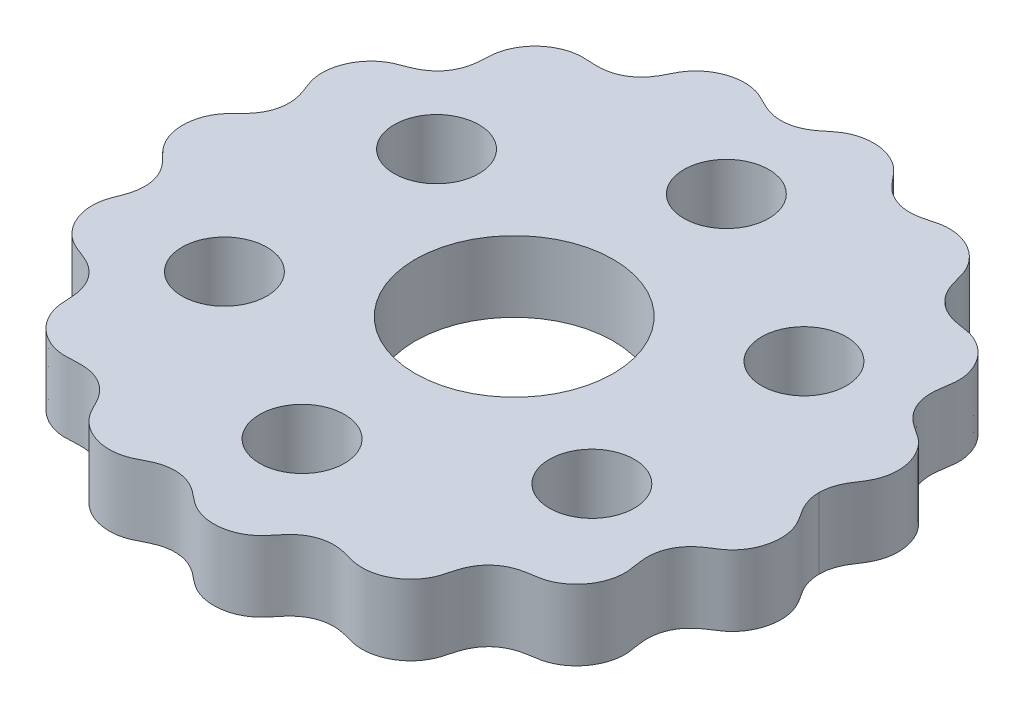
from build123d import *

# Parameters (mm, degrees)
BOSS_EXTRUDE1_DEPTH = 10
SKETCH2_R           = 14
SKETCH2_R_2         = 6
CUT_EXTRUDE1_DEPTH  = 10


with BuildPart() as part:
    # Sketch1 → Boss-Extrude1 (new body)
    with BuildSketch(Plane(origin=(0, 0, 0), x_dir=(1, 0, 0), z_dir=(0, 1, 0))):
        with BuildLine():
            add(Edge.make_bspline(
                [(43.125, 0), (43.125, -0.04253376), (43.125842023, -0.105329029), (43.128648775, -0.219501248), (43.135019123, -0.352292602), (43.141932928, -0.454759474), (43.15293713, -0.582006478), (43.169926456, -0.737698323), (43.195057818, -0.920018582), (43.230988459, -1.126003403), (43.274023628, -1.331077263), (43.33656904, -1.585225597), (43.454877118, -1.987246867), (43.659957218, -2.526165865), (44.003257795, -3.208529191), (44.486703726, -3.963009603), (45.011710901, -4.724365647), (45.464881913, -5.566998571), (45.829789729, -6.583473472), (46.037635432, -7.769953603), (46.018876274, -9.108172689), (45.699173049, -10.541997716), (45.13241202, -11.790586356), (44.391420513, -12.821058061), (43.553658534, -13.62486626), (42.686773685, -14.218656762), (41.847173706, -14.723738241), (41.113010158, -15.27010197), (40.356508237, -15.984911286), (39.64401467, -16.920938383), (39.065487742, -18.176194843), (38.821808048, -19.614860862), (38.883740817, -20.808738979), (39.036511831, -21.728716893), (39.149999061, -22.395010733), (39.218485568, -22.931744545), (39.256494717, -23.607184213), (39.20773201, -24.529298073), (38.956646376, -25.675266369), (38.383638085, -26.966438066), (37.491280365, -28.188034586), (36.456233226, -29.112194815), (35.371495342, -29.751280862), (34.300362256, -30.144907835), (33.296839208, -30.340567925), (32.34235617, -30.45668892), (31.455433855, -30.643043045), (30.650677042, -30.910490339), (29.936591375, -31.250491088), (29.11286761, -31.781933535), (28.252053762, -32.581040774), (27.616924672, -33.501658002), (27.196078853, -34.46335063), (26.957088965, -35.223334671), (26.81673532, -35.752261367), (26.683233633, -36.282678413), (26.531216493, -36.808512671), (26.297110502, -37.451705898), (25.883256178, -38.290560319), (25.188270048, -39.256343387), (24.124812446, -40.230448913), (22.778201742, -41.008012636), (21.402888244, -41.44171185), (20.21887944, -41.561053404), (19.285736569, -41.499490672), (18.47628618, -41.357950231), (17.68481965, -41.139805876), (16.656909007, -40.841140025), (15.342614716, -40.657065554), (13.891256715, -40.773177402), (12.591917321, -41.237982668), (11.591762454, -41.868412598), (10.809846945, -42.562675581), (10.205148907, -43.237679616), (9.62724817, -44.006173799), (8.95609046, -44.777447386), (8.079608407, -45.508249162), (6.983789251, -46.128124512), (5.665910241, -46.562416571), (4.161803775, -46.724425993), (2.757108076, -46.575077706), (1.639130281, -46.219541522), (0.816173285, -45.800713485), (0.250230967, -45.430077279), (-0.180351589, -45.102399012), (-0.700634877, -44.670969398), (-1.420974084, -44.078676847), (-2.423935916, -43.428102369), (-3.791697811, -42.919802312), (-5.168044297, -42.793192865), (-6.334915625, -42.942217189), (-7.332207563, -43.239961851), (-8.172458729, -43.602585529), (-9.029663207, -44.077157208), (-9.977356856, -44.531010068), (-11.0923363, -44.854623518), (-12.355278272, -44.98111416), (-13.737494876, -44.845914812), (-15.171813178, -44.390479958), (-16.39183502, -43.692656976), (-17.269283362, -42.922687499), (-17.853346372, -42.213210816), (-18.222154822, -41.649928431), (-18.48392233, -41.179315476), (-18.783866284, -40.577170893), (-19.19551646, -39.74553523), (-19.834531711, -38.742366458), (-20.862240201, -37.71220112), (-22.228604102, -36.923330554), (-23.6346077, -36.548391563), (-24.822884966, -36.496572508), (-25.748927665, -36.55589083), (-26.420372148, -36.597204037), (-26.958818676, -36.605813203), (-27.631039756, -36.568056908), (-28.537496092, -36.416981846), (-29.64303339, -36.04207403), (-30.857376741, -35.334415612), (-31.968954045, -34.319976953), (-32.777148417, -33.190541935), (-33.299075294, -32.033556783), (-33.576307547, -30.906149533), (-33.657106265, -29.85849633), (-33.674717375, -28.878849634), (-33.780801638, -27.969858942), (-34.02159317, -26.957306454), (-34.475969978, -25.872254085), (-35.273790229, -24.743607776), (-36.397871921, -23.813241276), (-37.46276689, -23.269938061), (-38.335876844, -22.94225233), (-38.969647574, -22.707388509), (-39.468716405, -22.498332367), (-40.072668176, -22.193529794), (-40.846862001, -21.690242557), (-41.713754922, -20.899812792), (-42.545441183, -19.757985818), (-43.157191622, -18.374385154), (-43.440020903, -17.015924787), (-43.451106264, -15.75697615), (-43.256448335, -14.632525841), (-42.9240971, -13.665636507), (-42.547488448, -12.78093696), (-42.265303916, -11.9197138), (-42.05495271, -10.89547875), (-42.016706106, -9.908186807), (-42.151176327, -8.933043452), (-42.451756736, -8.004318322), (-42.782221005, -7.303895351), (-43.24001438, -6.582366244), (-43.837169383, -5.861382973), (-44.470557981, -5.254411711), (-45.055286307, -4.678236723), (-45.494411749, -4.152537393), (-45.811419257, -3.706270708), (-46.068393708, -3.268571236), (-46.274068237, -2.849742032), (-46.435847202, -2.455249672), (-46.561708447, -2.09053676), (-46.653497015, -1.76554208), (-46.719145848, -1.483772319), (-46.765092539, -1.247079973), (-46.796615034, -1.056810016), (-46.822884874, -0.865953903), (-46.843904414, -0.673173674), (-46.857699771, -0.506964881), (-46.866240226, -0.363599971), (-46.871167554, -0.236183528), (-46.873795508, -0.132018435), (-46.874781002, -0.061861362), (-46.875, -0.020519481), (-46.875, 0)],
                knots=[0.073379942, 0.073379942, 0.073379942, 0.073379942, 0.073379942, 0.074471538, 0.075017335, 0.075563133, 0.076134945, 0.076706758, 0.077850382, 0.078994007, 0.080137631, 0.081281256, 0.082424881, 0.08471213, 0.089286628, 0.093861126, 0.099069298, 0.104277469, 0.109485641, 0.114693812, 0.122572784, 0.130451757, 0.138511613, 0.146571469, 0.152296032, 0.158020594, 0.163745157, 0.169469719, 0.173712688, 0.177955657, 0.186441594, 0.195001278, 0.203560962, 0.20946737, 0.212420574, 0.215373778, 0.218326982, 0.221280186, 0.227186594, 0.235488461, 0.243790327, 0.251894239, 0.259998151, 0.26556746, 0.271136768, 0.276706077, 0.282275385, 0.286582441, 0.290889497, 0.295196553, 0.299503609, 0.307939116, 0.316374624, 0.319362447, 0.322350271, 0.325338094, 0.328325918, 0.331313742, 0.334301565, 0.340277212, 0.348703072, 0.357128932, 0.365554792, 0.373980652, 0.379956299, 0.382944123, 0.385931946, 0.391907594, 0.397883241, 0.406318748, 0.414754256, 0.423368367, 0.427675423, 0.431982479, 0.437551788, 0.443121096, 0.448690405, 0.454259714, 0.462363625, 0.470467537, 0.478769404, 0.48707127, 0.492977678, 0.495930882, 0.498884086, 0.50183729, 0.504790494, 0.510696902, 0.519256586, 0.527816271, 0.536302208, 0.540545176, 0.544788145, 0.550512708, 0.55623727, 0.561961833, 0.567686395, 0.575746252, 0.583806108, 0.59206794, 0.600329772, 0.606207918, 0.609146991, 0.612086064, 0.615025138, 0.617964211, 0.623842357, 0.632360151, 0.640877945, 0.649395738, 0.657913532, 0.663791678, 0.666730752, 0.669669825, 0.672608898, 0.675547971, 0.681426118, 0.68968795, 0.697949782, 0.706009638, 0.714069494, 0.719794057, 0.725518619, 0.731243182, 0.736967744, 0.741210713, 0.745453681, 0.753939619, 0.762499303, 0.771058987, 0.776965395, 0.779918599, 0.782871803, 0.785825007, 0.788778211, 0.794684619, 0.802986486, 0.811288352, 0.819392264, 0.827496176, 0.833065484, 0.838634793, 0.844204102, 0.84977341, 0.854080466, 0.858387522, 0.867001634, 0.871219387, 0.875437141, 0.879654895, 0.883872649, 0.889848296, 0.895823943, 0.898811766, 0.90179959, 0.904787413, 0.907775237, 0.909881702, 0.911988167, 0.914094632, 0.916201097, 0.917254329, 0.918307562, 0.919360794, 0.920414027, 0.92146726, 0.922520492, 0.923047108, 0.923573725, 0.924100341, 0.924626957, 0.924626957, 0.924626957, 0.924626957, 0.924626957], degree=4))
            add(Edge.make_bspline(
                [(43.125, 0), (43.125, 0.04253376), (43.125842023, 0.105329029), (43.128648775, 0.219501248), (43.135019123, 0.352292602), (43.141932928, 0.454759474), (43.15293713, 0.582006478), (43.169926456, 0.737698323), (43.195057818, 0.920018582), (43.230988459, 1.126003403), (43.274023628, 1.331077263), (43.33656904, 1.585225597), (43.454877118, 1.987246867), (43.659957218, 2.526165865), (44.003257795, 3.208529191), (44.486703726, 3.963009603), (45.011710901, 4.724365647), (45.464881913, 5.566998571), (45.829789729, 6.583473472), (46.037635432, 7.769953603), (46.018876274, 9.108172689), (45.699173049, 10.541997716), (45.13241202, 11.790586356), (44.391420513, 12.821058061), (43.553658534, 13.62486626), (42.686773685, 14.218656762), (41.847173706, 14.723738241), (41.113010158, 15.27010197), (40.356508237, 15.984911286), (39.64401467, 16.920938383), (39.065487742, 18.176194843), (38.821808048, 19.614860862), (38.883740817, 20.808738979), (39.036511831, 21.728716893), (39.149999061, 22.395010733), (39.218485568, 22.931744545), (39.256494717, 23.607184213), (39.20773201, 24.529298073), (38.956646376, 25.675266369), (38.383638085, 26.966438066), (37.491280365, 28.188034586), (36.456233226, 29.112194815), (35.371495342, 29.751280862), (34.300362256, 30.144907835), (33.296839208, 30.340567925), (32.34235617, 30.45668892), (31.455433855, 30.643043045), (30.650677042, 30.910490339), (29.936591375, 31.250491088), (29.11286761, 31.781933535), (28.252053762, 32.581040774), (27.616924672, 33.501658002), (27.196078853, 34.46335063), (26.957088965, 35.223334671), (26.81673532, 35.752261367), (26.683233633, 36.282678413), (26.531216493, 36.808512671), (26.297110502, 37.451705898), (25.883256178, 38.290560319), (25.188270048, 39.256343387), (24.124812446, 40.230448913), (22.778201742, 41.008012636), (21.402888244, 41.44171185), (20.21887944, 41.561053404), (19.285736569, 41.499490672), (18.47628618, 41.357950231), (17.68481965, 41.139805876), (16.656909007, 40.841140025), (15.342614716, 40.657065554), (13.891256715, 40.773177402), (12.591917321, 41.237982668), (11.591762454, 41.868412598), (10.809846945, 42.562675581), (10.205148907, 43.237679616), (9.62724817, 44.006173799), (8.95609046, 44.777447386), (8.079608407, 45.508249162), (6.983789251, 46.128124512), (5.665910241, 46.562416571), (4.161803775, 46.724425993), (2.757108076, 46.575077706), (1.639130281, 46.219541522), (0.816173285, 45.800713485), (0.250230967, 45.430077279), (-0.180351589, 45.102399012), (-0.700634877, 44.670969398), (-1.420974084, 44.078676847), (-2.423935916, 43.428102369), (-3.791697811, 42.919802312), (-5.168044297, 42.793192865), (-6.334915625, 42.942217189), (-7.332207563, 43.239961851), (-8.172458729, 43.602585529), (-9.029663207, 44.077157208), (-9.977356856, 44.531010068), (-11.0923363, 44.854623518), (-12.355278272, 44.98111416), (-13.737494876, 44.845914812), (-15.171813178, 44.390479958), (-16.39183502, 43.692656976), (-17.269283362, 42.922687499), (-17.853346372, 42.213210816), (-18.222154822, 41.649928431), (-18.48392233, 41.179315476), (-18.783866284, 40.577170893), (-19.19551646, 39.74553523), (-19.834531711, 38.742366458), (-20.862240201, 37.71220112), (-22.228604102, 36.923330554), (-23.6346077, 36.548391563), (-24.822884966, 36.496572508), (-25.748927665, 36.55589083), (-26.420372148, 36.597204037), (-26.958818676, 36.605813203), (-27.631039756, 36.568056908), (-28.537496092, 36.416981846), (-29.64303339, 36.04207403), (-30.857376741, 35.334415612), (-31.968954045, 34.319976953), (-32.777148417, 33.190541935), (-33.299075294, 32.033556783), (-33.576307547, 30.906149533), (-33.657106265, 29.85849633), (-33.674717375, 28.878849634), (-33.780801638, 27.969858942), (-34.02159317, 26.957306454), (-34.475969978, 25.872254085), (-35.273790229, 24.743607776), (-36.397871921, 23.813241276), (-37.46276689, 23.269938061), (-38.335876844, 22.94225233), (-38.969647574, 22.707388509), (-39.468716405, 22.498332367), (-40.072668176, 22.193529794), (-40.846862001, 21.690242557), (-41.713754922, 20.899812792), (-42.545441183, 19.757985818), (-43.157191622, 18.374385154), (-43.440020903, 17.015924787), (-43.451106264, 15.75697615), (-43.256448335, 14.632525841), (-42.9240971, 13.665636507), (-42.547488448, 12.78093696), (-42.265303916, 11.9197138), (-42.05495271, 10.89547875), (-42.016706106, 9.908186807), (-42.151176327, 8.933043452), (-42.451756736, 8.004318322), (-42.782221005, 7.303895351), (-43.24001438, 6.582366244), (-43.837169383, 5.861382973), (-44.470557981, 5.254411711), (-45.055286307, 4.678236723), (-45.494411749, 4.152537393), (-45.811419257, 3.706270708), (-46.068393708, 3.268571236), (-46.274068237, 2.849742032), (-46.435847202, 2.455249672), (-46.561708447, 2.09053676), (-46.653497015, 1.76554208), (-46.719145848, 1.483772319), (-46.765092539, 1.247079973), (-46.796615034, 1.056810016), (-46.822884874, 0.865953903), (-46.843904414, 0.673173674), (-46.857699771, 0.506964881), (-46.866240226, 0.363599971), (-46.871167554, 0.236183528), (-46.873795508, 0.132018435), (-46.874781002, 0.061861362), (-46.875, 0.020519481), (-46.875, 0)],
                knots=[0.073379942, 0.073379942, 0.073379942, 0.073379942, 0.073379942, 0.074471538, 0.075017335, 0.075563133, 0.076134945, 0.076706758, 0.077850382, 0.078994007, 0.080137631, 0.081281256, 0.082424881, 0.08471213, 0.089286628, 0.093861126, 0.099069298, 0.104277469, 0.109485641, 0.114693812, 0.122572784, 0.130451757, 0.138511613, 0.146571469, 0.152296032, 0.158020594, 0.163745157, 0.169469719, 0.173712688, 0.177955657, 0.186441594, 0.195001278, 0.203560962, 0.20946737, 0.212420574, 0.215373778, 0.218326982, 0.221280186, 0.227186594, 0.235488461, 0.243790327, 0.251894239, 0.259998151, 0.26556746, 0.271136768, 0.276706077, 0.282275385, 0.286582441, 0.290889497, 0.295196553, 0.299503609, 0.307939116, 0.316374624, 0.319362447, 0.322350271, 0.325338094, 0.328325918, 0.331313742, 0.334301565, 0.340277212, 0.348703072, 0.357128932, 0.365554792, 0.373980652, 0.379956299, 0.382944123, 0.385931946, 0.391907594, 0.397883241, 0.406318748, 0.414754256, 0.423368367, 0.427675423, 0.431982479, 0.437551788, 0.443121096, 0.448690405, 0.454259714, 0.462363625, 0.470467537, 0.478769404, 0.48707127, 0.492977678, 0.495930882, 0.498884086, 0.50183729, 0.504790494, 0.510696902, 0.519256586, 0.527816271, 0.536302208, 0.540545176, 0.544788145, 0.550512708, 0.55623727, 0.561961833, 0.567686395, 0.575746252, 0.583806108, 0.59206794, 0.600329772, 0.606207918, 0.609146991, 0.612086064, 0.615025138, 0.617964211, 0.623842357, 0.632360151, 0.640877945, 0.649395738, 0.657913532, 0.663791678, 0.666730752, 0.669669825, 0.672608898, 0.675547971, 0.681426118, 0.68968795, 0.697949782, 0.706009638, 0.714069494, 0.719794057, 0.725518619, 0.731243182, 0.736967744, 0.741210713, 0.745453681, 0.753939619, 0.762499303, 0.771058987, 0.776965395, 0.779918599, 0.782871803, 0.785825007, 0.788778211, 0.794684619, 0.802986486, 0.811288352, 0.819392264, 0.827496176, 0.833065484, 0.838634793, 0.844204102, 0.84977341, 0.854080466, 0.858387522, 0.867001634, 0.871219387, 0.875437141, 0.879654895, 0.883872649, 0.889848296, 0.895823943, 0.898811766, 0.90179959, 0.904787413, 0.907775237, 0.909881702, 0.911988167, 0.914094632, 0.916201097, 0.917254329, 0.918307562, 0.919360794, 0.920414027, 0.92146726, 0.922520492, 0.923047108, 0.923573725, 0.924100341, 0.924626957, 0.924626957, 0.924626957, 0.924626957, 0.924626957], degree=4))
        make_face()
    extrude(amount=BOSS_EXTRUDE1_DEPTH)

    # Sketch2 → Cut-Extrude1 (cut)
    with BuildSketch(Plane(origin=(0, 10, 0), x_dir=(1, 0, 0), z_dir=(0, 1, 0))):
        Circle(SKETCH2_R)
        with Locations((0, 30)):
            Circle(SKETCH2_R_2)
        with Locations((25.980762114, 15)):
            Circle(SKETCH2_R_2)
        with Locations((25.980762114, -15)):
            Circle(SKETCH2_R_2)
        with Locations((0, -30)):
            Circle(SKETCH2_R_2)
        with Locations((-25.980762114, -15)):
            Circle(SKETCH2_R_2)
        with Locations((-25.980762114, 15)):
            Circle(SKETCH2_R_2)
    extrude(amount=-CUT_EXTRUDE1_DEPTH, mode=Mode.SUBTRACT)


solid = part.part
